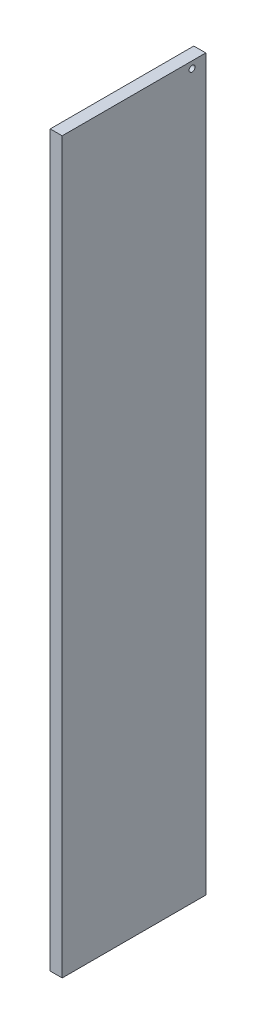
from build123d import *

# Parameters (mm, degrees)
SKETCH1_W           = 76.2
SKETCH1_H           = 387.096
BOSS_EXTRUDE1_DEPTH = 6.35
CUT_EXTRUDE1_REACH  = 199.365
SKETCH2_R           = 1.5875


with BuildPart() as part:
    # Sketch1 → Boss-Extrude1 (new body)
    with BuildSketch(Plane(origin=(0, 0, 0), x_dir=(0, 0, -1), z_dir=(1, 0, 0))):
        Rectangle(SKETCH1_W, SKETCH1_H)
    extrude(amount=BOSS_EXTRUDE1_DEPTH)

    # Sketch2 → Cut-Extrude1 (cut, up to next)
    with BuildSketch(Plane(origin=(6.35, 0, 0), x_dir=(0, 0, -1), z_dir=(1, 0, 0)), mode=Mode.PRIVATE) as cut_extrude1_sk1:
        with Locations((30.816663564, 189.929324987)):
            Circle(SKETCH2_R)
    cut_extrude1_tool1 = extrude(cut_extrude1_sk1.sketch, amount=-CUT_EXTRUDE1_REACH, mode=Mode.PRIVATE) & part.part
    add(cut_extrude1_tool1.solids().sort_by_distance((6.35, 189.929325, -30.816664))[0], mode=Mode.SUBTRACT)


solid = part.part
